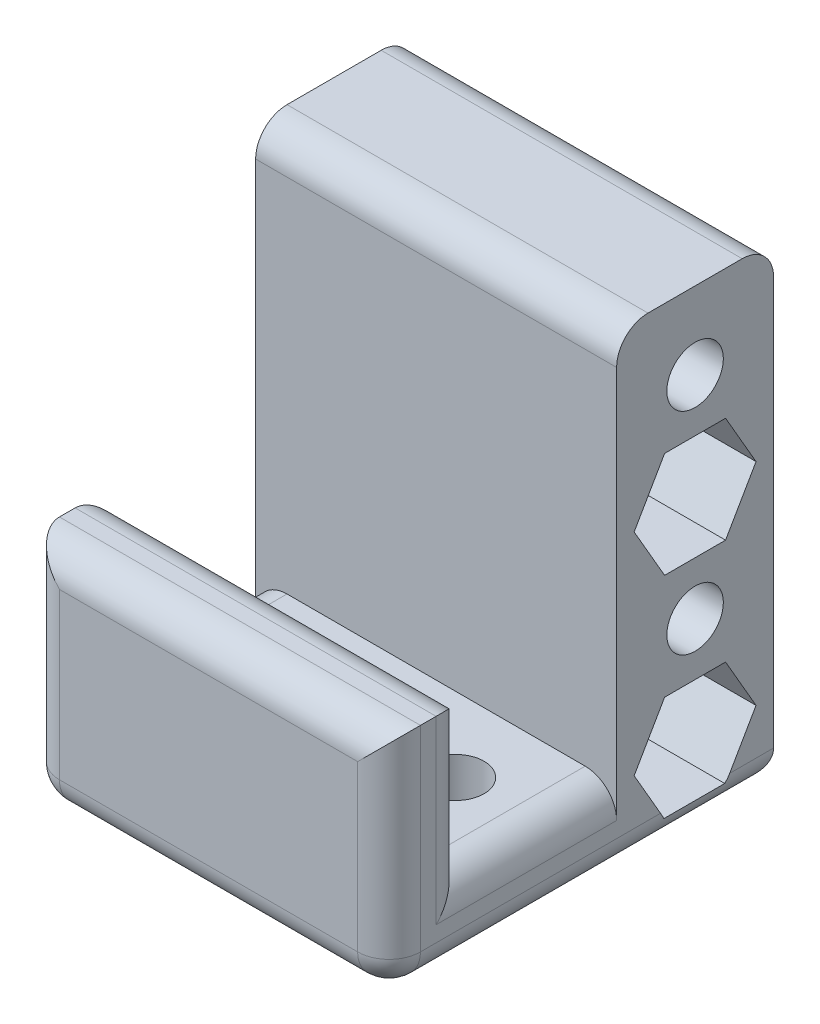
from build123d import *

# Parameters (mm, degrees)
SKETCH1_R               = 1.8
BOSS_EXTRUDE1_DEPTH     = 11.5
CUT_EXTRUDE1_START      = -5
SKETCH1_3_R             = 1.8
CUT_EXTRUDE1_DEPTH      = 18.523598736
CUT_EXTRUDE2_START      = 5
SKETCH1_4_R             = 1.8
CUT_EXTRUDE2_DEPTH      = 18.523598736
CUT_EXTRUDE3_DEPTH      = 23.523598736
CUT_EXTRUDE3_DEPTH_BACK = 23.523598736
SKETCH2_R               = 1.8
FILLET1_R               = 2


with BuildPart() as part:
    # Sketch1 → Boss-Extrude1 (new, symmetric)
    with BuildSketch(Plane(origin=(0, 0, 0), x_dir=(0, 0, -1), z_dir=(1, 0, 0))):
        Polygon((-12.25, -0.5), (-7.25, -0.5), (-7.25, -10), (2.25, -10), (2.25, 15), (12.25, 15), (12.25, -15), (-12.25, -15), align=None)
        with Locations((7.25, 10.0887)):
            Circle(SKETCH1_R, mode=Mode.SUBTRACT)
        with Locations((7.25, 3.3629)):
            Circle(SKETCH1_R, mode=Mode.SUBTRACT)
        with Locations((7.25, -3.3629)):
            Circle(SKETCH1_R, mode=Mode.SUBTRACT)
        with Locations((7.25, -10.0887)):
            Circle(SKETCH1_R, mode=Mode.SUBTRACT)
    extrude(amount=BOSS_EXTRUDE1_DEPTH, both=True)

    # Sketch1<3> → Cut-Extrude1 (cut, through all)
    # profile 1 of 2: a face of its own
    with BuildSketch(Plane(origin=(0, 0, 0), x_dir=(0, 0, -1), z_dir=(1, 0, 0)).offset(CUT_EXTRUDE1_START)):
        Polygon((9.19157122, 13.4516), (5.30842878, 13.4516), (3.366857559, 10.0887), (5.30842878, 6.7258), (9.19157122, 6.7258), (11.133142441, 10.0887), align=None)
        with Locations((7.25, 10.0887)):
            Circle(SKETCH1_3_R, mode=Mode.SUBTRACT)
    # profile 2 of 2: a face of its own
    with BuildSketch(Plane(origin=(0, 0, 0), x_dir=(0, 0, -1), z_dir=(1, 0, 0)).offset(CUT_EXTRUDE1_START)):
        Polygon((5.30842878, 0), (9.19157122, 0), (11.133142441, -3.3629), (9.19157122, -6.7258), (5.30842878, -6.7258), (3.366857559, -3.3629), align=None)
        with Locations((7.25, -3.3629)):
            Circle(SKETCH1_3_R, mode=Mode.SUBTRACT)
    extrude(amount=-CUT_EXTRUDE1_DEPTH, mode=Mode.SUBTRACT)

    # Sketch1<4> → Cut-Extrude2 (cut, through all)
    # profile 1 of 2: a face of its own
    with BuildSketch(Plane(origin=(0, 0, 0), x_dir=(0, 0, -1), z_dir=(1, 0, 0)).offset(CUT_EXTRUDE2_START)):
        Polygon((5.30842878, 6.7258), (9.19157122, 6.7258), (11.133142441, 3.3629), (9.19157122, 0), (5.30842878, 0), (3.366857559, 3.3629), align=None)
        with Locations((7.25, 3.3629)):
            Circle(SKETCH1_4_R, mode=Mode.SUBTRACT)
    # profile 2 of 2: a face of its own
    with BuildSketch(Plane(origin=(0, 0, 0), x_dir=(0, 0, -1), z_dir=(1, 0, 0)).offset(CUT_EXTRUDE2_START)):
        Polygon((5.30842878, -6.7258), (9.19157122, -6.7258), (11.133142441, -10.0887), (9.19157122, -13.4516), (5.30842878, -13.4516), (3.366857559, -10.0887), align=None)
        with Locations((7.25, -10.0887)):
            Circle(SKETCH1_4_R, mode=Mode.SUBTRACT)
    extrude(amount=CUT_EXTRUDE2_DEPTH, mode=Mode.SUBTRACT)

    # Sketch2 → Cut-Extrude3 (cut, two sides: drawn at the far end of the back side and taken through both)
    with BuildSketch(Plane(origin=(0, 0, 0), x_dir=(1, 0, 0), z_dir=(0, 1, 0)).offset(-CUT_EXTRUDE3_DEPTH_BACK)):
        with Locations(Location((-6, -2.5, 0), (0, 0, 270))):
            Circle(SKETCH2_R)
        with Locations(Location((6, -2.5, 0), (0, 0, 270))):
            Circle(SKETCH2_R)
    extrude(amount=CUT_EXTRUDE3_DEPTH + CUT_EXTRUDE3_DEPTH_BACK, mode=Mode.SUBTRACT)

    # Fillet1
    # the kernel refuses this fillet: 2 mm, written as the material it takes off along each edge
    with BuildSketch(Plane(origin=(-9.5, -13, 10.25), x_dir=(-1, 0, 0), z_dir=(0, 0, 1))) as fillet1_piece_1_section:
        Polygon((0, 0), (FILLET1_R * 1.02, 0), (FILLET1_R * 1.02, FILLET1_R * 1.02), (0, FILLET1_R * 1.02), align=None)
    fillet1_piece_1 = extrude(amount=FILLET1_R * 1.02, mode=Mode.PRIVATE)
    fillet1_piece_1 = fillet1_piece_1 - Plane(origin=(-9.5, -13, 10.25), x_dir=(0.7071067811865475, 0.7071067811865475, 0), z_dir=(0, 0, 1)) * Sphere(FILLET1_R, mode=Mode.PRIVATE)
    add(fillet1_piece_1, mode=Mode.SUBTRACT)
    with BuildSketch(Plane(origin=(9.5, -13, 10.25), x_dir=(1, 0, 0), z_dir=(0, 0, 1))) as fillet1_piece_2_section:
        Polygon((0, 0), (FILLET1_R * 1.02, 0), (FILLET1_R * 1.02, -FILLET1_R * 1.02), (0, -FILLET1_R * 1.02), align=None)
    fillet1_piece_2 = extrude(amount=FILLET1_R * 1.02, mode=Mode.PRIVATE)
    fillet1_piece_2 = fillet1_piece_2 - Plane(origin=(9.5, -13, 10.25), x_dir=(-0.7071067811865475, 0.7071067811865475, 0), z_dir=(0, 0, 1)) * Sphere(FILLET1_R, mode=Mode.PRIVATE)
    add(fillet1_piece_2, mode=Mode.SUBTRACT)
    with BuildSketch(Plane(origin=(-11.5, -10, 7.25), x_dir=(0, -1, 0), z_dir=(0, 0, -1)), Plane(origin=(-11.5, -0.5, 7.25), x_dir=(0, 0, 1), z_dir=(0, -1, 0)), Plane(origin=(11.5, -0.5, 7.25), x_dir=(-1, 0, 0), z_dir=(0, -1, 0))) as fillet1_piece_3:
        with BuildLine():
            CenterArc((FILLET1_R, -FILLET1_R), FILLET1_R, 90, 90)
            Line((0, -FILLET1_R), (-FILLET1_R * 0.02, -FILLET1_R))
            Line((-FILLET1_R * 0.02, -FILLET1_R), (-FILLET1_R * 0.02, FILLET1_R * 0.02))
            Line((-FILLET1_R * 0.02, FILLET1_R * 0.02), (FILLET1_R, FILLET1_R * 0.02))
            Line((FILLET1_R, FILLET1_R * 0.02), (FILLET1_R, 0))
        make_face()
    extrude(amount=9.5, mode=Mode.SUBTRACT)
    with BuildSketch(Plane(origin=(11.5, -10, 7.25), x_dir=(0, -1, 0), z_dir=(0, 0, -1))) as fillet1_piece_4:
        with BuildLine():
            CenterArc((FILLET1_R, FILLET1_R), FILLET1_R, 180, 90)
            Line((0, FILLET1_R), (-FILLET1_R * 0.02, FILLET1_R))
            Line((-FILLET1_R * 0.02, FILLET1_R), (-FILLET1_R * 0.02, -FILLET1_R * 0.02))
            Line((-FILLET1_R * 0.02, -FILLET1_R * 0.02), (FILLET1_R, -FILLET1_R * 0.02))
            Line((FILLET1_R, -FILLET1_R * 0.02), (FILLET1_R, 0))
        make_face()
    extrude(amount=9.5, mode=Mode.SUBTRACT)
    with BuildSketch(Plane(origin=(-11.5, -15, -12.25), x_dir=(0, 1, 0), z_dir=(0, 0, 1))) as fillet1_piece_5:
        with BuildLine():
            CenterArc((FILLET1_R, -FILLET1_R), FILLET1_R, 90, 90)
            Line((0, -FILLET1_R), (-FILLET1_R * 0.02, -FILLET1_R))
            Line((-FILLET1_R * 0.02, -FILLET1_R), (-FILLET1_R * 0.02, FILLET1_R * 0.02))
            Line((-FILLET1_R * 0.02, FILLET1_R * 0.02), (FILLET1_R, FILLET1_R * 0.02))
            Line((FILLET1_R, FILLET1_R * 0.02), (FILLET1_R, 0))
        make_face()
    extrude(amount=22.5, mode=Mode.SUBTRACT)
    with BuildSketch(Plane(origin=(11.5, -15, -12.25), x_dir=(0, 1, 0), z_dir=(0, 0, 1))) as fillet1_piece_6:
        with BuildLine():
            CenterArc((FILLET1_R, FILLET1_R), FILLET1_R, 180, 90)
            Line((0, FILLET1_R), (-FILLET1_R * 0.02, FILLET1_R))
            Line((-FILLET1_R * 0.02, FILLET1_R), (-FILLET1_R * 0.02, -FILLET1_R * 0.02))
            Line((-FILLET1_R * 0.02, -FILLET1_R * 0.02), (FILLET1_R, -FILLET1_R * 0.02))
            Line((FILLET1_R, -FILLET1_R * 0.02), (FILLET1_R, 0))
        make_face()
    extrude(amount=22.5, mode=Mode.SUBTRACT)
    with BuildSketch(Plane(origin=(-11.5, -13, 12.25), x_dir=(1, 0, 0), z_dir=(0, 1, 0))) as fillet1_piece_7:
        with BuildLine():
            CenterArc((FILLET1_R, FILLET1_R), FILLET1_R, 180, 90)
            Line((0, FILLET1_R), (-FILLET1_R * 0.02, FILLET1_R))
            Line((-FILLET1_R * 0.02, FILLET1_R), (-FILLET1_R * 0.02, -FILLET1_R * 0.02))
            Line((-FILLET1_R * 0.02, -FILLET1_R * 0.02), (FILLET1_R, -FILLET1_R * 0.02))
            Line((FILLET1_R, -FILLET1_R * 0.02), (FILLET1_R, 0))
        make_face()
    extrude(amount=12.5, mode=Mode.SUBTRACT)
    with BuildSketch(Plane(origin=(11.5, -13, 12.25), x_dir=(-1, 0, 0), z_dir=(0, 1, 0))) as fillet1_piece_8:
        with BuildLine():
            CenterArc((FILLET1_R, -FILLET1_R), FILLET1_R, 90, 90)
            Line((0, -FILLET1_R), (-FILLET1_R * 0.02, -FILLET1_R))
            Line((-FILLET1_R * 0.02, -FILLET1_R), (-FILLET1_R * 0.02, FILLET1_R * 0.02))
            Line((-FILLET1_R * 0.02, FILLET1_R * 0.02), (FILLET1_R, FILLET1_R * 0.02))
            Line((FILLET1_R, FILLET1_R * 0.02), (FILLET1_R, 0))
        make_face()
    extrude(amount=12.5, mode=Mode.SUBTRACT)
    with BuildSketch(Plane(origin=(11.5, 15, -2.25), x_dir=(0, -1, 0), z_dir=(-1, 0, 0)), Plane(origin=(-11.5, -15, -12.25), x_dir=(0, 0, 1), z_dir=(1, 0, 0)), Plane(origin=(11.5, -0.5, 7.25), x_dir=(0, 0, 1), z_dir=(-1, 0, 0)), Plane(origin=(-11.5, -0.5, 12.25), x_dir=(0, 0, -1), z_dir=(1, 0, 0))) as fillet1_piece_9:
        with BuildLine():
            CenterArc((FILLET1_R, -FILLET1_R), FILLET1_R, 90, 90)
            Line((0, -FILLET1_R), (-FILLET1_R * 0.02, -FILLET1_R))
            Line((-FILLET1_R * 0.02, -FILLET1_R), (-FILLET1_R * 0.02, FILLET1_R * 0.02))
            Line((-FILLET1_R * 0.02, FILLET1_R * 0.02), (FILLET1_R, FILLET1_R * 0.02))
            Line((FILLET1_R, FILLET1_R * 0.02), (FILLET1_R, 0))
        make_face()
    extrude(amount=23, mode=Mode.SUBTRACT)
    with BuildSketch(Plane(origin=(11.5, 15, -12.25), x_dir=(0, -1, 0), z_dir=(-1, 0, 0))) as fillet1_piece_10:
        with BuildLine():
            CenterArc((FILLET1_R, FILLET1_R), FILLET1_R, 180, 90)
            Line((0, FILLET1_R), (-FILLET1_R * 0.02, FILLET1_R))
            Line((-FILLET1_R * 0.02, FILLET1_R), (-FILLET1_R * 0.02, -FILLET1_R * 0.02))
            Line((-FILLET1_R * 0.02, -FILLET1_R * 0.02), (FILLET1_R, -FILLET1_R * 0.02))
            Line((FILLET1_R, -FILLET1_R * 0.02), (FILLET1_R, 0))
        make_face()
    extrude(amount=23, mode=Mode.SUBTRACT)
    with BuildSketch(Plane(origin=(-9.5, -15, 12.25), x_dir=(0, 1, 0), z_dir=(1, 0, 0))) as fillet1_piece_11:
        with BuildLine():
            CenterArc((FILLET1_R, -FILLET1_R), FILLET1_R, 90, 90)
            Line((0, -FILLET1_R), (-FILLET1_R * 0.02, -FILLET1_R))
            Line((-FILLET1_R * 0.02, -FILLET1_R), (-FILLET1_R * 0.02, FILLET1_R * 0.02))
            Line((-FILLET1_R * 0.02, FILLET1_R * 0.02), (FILLET1_R, FILLET1_R * 0.02))
            Line((FILLET1_R, FILLET1_R * 0.02), (FILLET1_R, 0))
        make_face()
    extrude(amount=19, mode=Mode.SUBTRACT)
    with BuildSketch(Plane(origin=(-11.5, -0.5, 7.25), x_dir=(0, 0, 1), z_dir=(0, -1, 0))) as fillet1_piece_12a_section:
        with BuildLine():
            CenterArc((FILLET1_R, -FILLET1_R), FILLET1_R, 90, 90)
            Line((0, -FILLET1_R), (-FILLET1_R * 0.02, -FILLET1_R))
            Line((-FILLET1_R * 0.02, -FILLET1_R), (-FILLET1_R * 0.02, FILLET1_R * 0.02))
            Line((-FILLET1_R * 0.02, FILLET1_R * 0.02), (FILLET1_R, FILLET1_R * 0.02))
            Line((FILLET1_R, FILLET1_R * 0.02), (FILLET1_R, 0))
        make_face()
    fillet1_piece_12a = extrude(amount=14.5, mode=Mode.PRIVATE)
    fillet1_piece_12a = split(fillet1_piece_12a, bisect_by=Plane(origin=(-11.047209771, -10, 7.702790229), z_dir=(0, -1, 0)), keep=Keep.TOP, mode=Mode.PRIVATE)
    with BuildSketch(Plane(origin=(-11.5, -10, 12.25), x_dir=(0, -1, 0), z_dir=(0, 0, -1))) as fillet1_piece_12b_section:
        with BuildLine():
            CenterArc((FILLET1_R, -FILLET1_R), FILLET1_R, 90, 90)
            Line((0, -FILLET1_R), (-FILLET1_R * 0.02, -FILLET1_R))
            Line((-FILLET1_R * 0.02, -FILLET1_R), (-FILLET1_R * 0.02, FILLET1_R * 0.02))
            Line((-FILLET1_R * 0.02, FILLET1_R * 0.02), (FILLET1_R, FILLET1_R * 0.02))
            Line((FILLET1_R, FILLET1_R * 0.02), (FILLET1_R, 0))
        make_face()
    fillet1_piece_12b = extrude(amount=14.5, mode=Mode.PRIVATE)
    fillet1_piece_12b = split(fillet1_piece_12b, bisect_by=Plane(origin=(-11.047209771, -10.452790229, 7.25), z_dir=(0, 0, 1)), keep=Keep.TOP, mode=Mode.PRIVATE)
    fillet1_piece_12 = fillet1_piece_12a & fillet1_piece_12b
    add(fillet1_piece_12, mode=Mode.SUBTRACT)
    with BuildSketch(Plane(origin=(11.5, -0.5, 7.25), x_dir=(-1, 0, 0), z_dir=(0, -1, 0))) as fillet1_piece_13a_section:
        with BuildLine():
            CenterArc((FILLET1_R, -FILLET1_R), FILLET1_R, 90, 90)
            Line((0, -FILLET1_R), (-FILLET1_R * 0.02, -FILLET1_R))
            Line((-FILLET1_R * 0.02, -FILLET1_R), (-FILLET1_R * 0.02, FILLET1_R * 0.02))
            Line((-FILLET1_R * 0.02, FILLET1_R * 0.02), (FILLET1_R, FILLET1_R * 0.02))
            Line((FILLET1_R, FILLET1_R * 0.02), (FILLET1_R, 0))
        make_face()
    fillet1_piece_13a = extrude(amount=14.5, mode=Mode.PRIVATE)
    fillet1_piece_13a = split(fillet1_piece_13a, bisect_by=Plane(origin=(11.047209771, -10, 7.702790229), z_dir=(0, -1, 0)), keep=Keep.TOP, mode=Mode.PRIVATE)
    with BuildSketch(Plane(origin=(11.5, -10, 12.25), x_dir=(0, -1, 0), z_dir=(0, 0, -1))) as fillet1_piece_13b_section:
        with BuildLine():
            CenterArc((FILLET1_R, FILLET1_R), FILLET1_R, 180, 90)
            Line((0, FILLET1_R), (-FILLET1_R * 0.02, FILLET1_R))
            Line((-FILLET1_R * 0.02, FILLET1_R), (-FILLET1_R * 0.02, -FILLET1_R * 0.02))
            Line((-FILLET1_R * 0.02, -FILLET1_R * 0.02), (FILLET1_R, -FILLET1_R * 0.02))
            Line((FILLET1_R, -FILLET1_R * 0.02), (FILLET1_R, 0))
        make_face()
    fillet1_piece_13b = extrude(amount=14.5, mode=Mode.PRIVATE)
    fillet1_piece_13b = split(fillet1_piece_13b, bisect_by=Plane(origin=(11.047209771, -10.452790229, 7.25), z_dir=(0, 0, 1)), keep=Keep.TOP, mode=Mode.PRIVATE)
    fillet1_piece_13 = fillet1_piece_13a & fillet1_piece_13b
    add(fillet1_piece_13, mode=Mode.SUBTRACT)
    with BuildSketch(Plane(origin=(11.5, -0.5, 7.25), x_dir=(0, 0, 1), z_dir=(-1, 0, 0))) as fillet1_piece_14a_section:
        with BuildLine():
            CenterArc((FILLET1_R, -FILLET1_R), FILLET1_R, 90, 90)
            Line((0, -FILLET1_R), (-FILLET1_R * 0.02, -FILLET1_R))
            Line((-FILLET1_R * 0.02, -FILLET1_R), (-FILLET1_R * 0.02, FILLET1_R * 0.02))
            Line((-FILLET1_R * 0.02, FILLET1_R * 0.02), (FILLET1_R, FILLET1_R * 0.02))
            Line((FILLET1_R, FILLET1_R * 0.02), (FILLET1_R, 0))
        make_face()
    fillet1_piece_14a = extrude(amount=28, mode=Mode.PRIVATE)
    fillet1_piece_14a = split(fillet1_piece_14a, bisect_by=Plane(origin=(-11.5, -0.952790229, 7.702790229), z_dir=(-1, 0, 0)), keep=Keep.TOP, mode=Mode.PRIVATE)
    with BuildSketch(Plane(origin=(-11.5, 4.5, 7.25), x_dir=(0, 0, 1), z_dir=(0, -1, 0))) as fillet1_piece_14b_section:
        with BuildLine():
            CenterArc((FILLET1_R, -FILLET1_R), FILLET1_R, 90, 90)
            Line((0, -FILLET1_R), (-FILLET1_R * 0.02, -FILLET1_R))
            Line((-FILLET1_R * 0.02, -FILLET1_R), (-FILLET1_R * 0.02, FILLET1_R * 0.02))
            Line((-FILLET1_R * 0.02, FILLET1_R * 0.02), (FILLET1_R, FILLET1_R * 0.02))
            Line((FILLET1_R, FILLET1_R * 0.02), (FILLET1_R, 0))
        make_face()
    fillet1_piece_14b = extrude(amount=14.5, mode=Mode.PRIVATE)
    fillet1_piece_14b = split(fillet1_piece_14b, bisect_by=Plane(origin=(-11.047209771, -0.5, 7.702790229), z_dir=(0, 1, 0)), keep=Keep.TOP, mode=Mode.PRIVATE)
    fillet1_piece_14 = fillet1_piece_14a & fillet1_piece_14b
    add(fillet1_piece_14, mode=Mode.SUBTRACT)
    with BuildSketch(Plane(origin=(16.5, -0.5, 7.25), x_dir=(0, 0, 1), z_dir=(-1, 0, 0))) as fillet1_piece_15a_section:
        with BuildLine():
            CenterArc((FILLET1_R, -FILLET1_R), FILLET1_R, 90, 90)
            Line((0, -FILLET1_R), (-FILLET1_R * 0.02, -FILLET1_R))
            Line((-FILLET1_R * 0.02, -FILLET1_R), (-FILLET1_R * 0.02, FILLET1_R * 0.02))
            Line((-FILLET1_R * 0.02, FILLET1_R * 0.02), (FILLET1_R, FILLET1_R * 0.02))
            Line((FILLET1_R, FILLET1_R * 0.02), (FILLET1_R, 0))
        make_face()
    fillet1_piece_15a = extrude(amount=28, mode=Mode.PRIVATE)
    fillet1_piece_15a = split(fillet1_piece_15a, bisect_by=Plane(origin=(11.5, -0.952790229, 7.702790229), z_dir=(1, 0, 0)), keep=Keep.TOP, mode=Mode.PRIVATE)
    with BuildSketch(Plane(origin=(11.5, 4.5, 7.25), x_dir=(-1, 0, 0), z_dir=(0, -1, 0))) as fillet1_piece_15b_section:
        with BuildLine():
            CenterArc((FILLET1_R, -FILLET1_R), FILLET1_R, 90, 90)
            Line((0, -FILLET1_R), (-FILLET1_R * 0.02, -FILLET1_R))
            Line((-FILLET1_R * 0.02, -FILLET1_R), (-FILLET1_R * 0.02, FILLET1_R * 0.02))
            Line((-FILLET1_R * 0.02, FILLET1_R * 0.02), (FILLET1_R, FILLET1_R * 0.02))
            Line((FILLET1_R, FILLET1_R * 0.02), (FILLET1_R, 0))
        make_face()
    fillet1_piece_15b = extrude(amount=14.5, mode=Mode.PRIVATE)
    fillet1_piece_15b = split(fillet1_piece_15b, bisect_by=Plane(origin=(11.047209771, -0.5, 7.702790229), z_dir=(0, 1, 0)), keep=Keep.TOP, mode=Mode.PRIVATE)
    fillet1_piece_15 = fillet1_piece_15a & fillet1_piece_15b
    add(fillet1_piece_15, mode=Mode.SUBTRACT)
    with BuildSketch(Plane(origin=(-11.5, -15, -17.25), x_dir=(0, 1, 0), z_dir=(0, 0, 1))) as fillet1_piece_16a_section:
        with BuildLine():
            CenterArc((FILLET1_R, -FILLET1_R), FILLET1_R, 90, 90)
            Line((0, -FILLET1_R), (-FILLET1_R * 0.02, -FILLET1_R))
            Line((-FILLET1_R * 0.02, -FILLET1_R), (-FILLET1_R * 0.02, FILLET1_R * 0.02))
            Line((-FILLET1_R * 0.02, FILLET1_R * 0.02), (FILLET1_R, FILLET1_R * 0.02))
            Line((FILLET1_R, FILLET1_R * 0.02), (FILLET1_R, 0))
        make_face()
    fillet1_piece_16a = extrude(amount=27.5, mode=Mode.PRIVATE)
    fillet1_piece_16a = split(fillet1_piece_16a, bisect_by=Plane(origin=(-11.047209771, -14.547209771, -12.25), z_dir=(0, 0, -1)), keep=Keep.TOP, mode=Mode.PRIVATE)
    with BuildSketch(Plane(origin=(-16.5, -15, -12.25), x_dir=(0, 0, 1), z_dir=(1, 0, 0))) as fillet1_piece_16b_section:
        with BuildLine():
            CenterArc((FILLET1_R, -FILLET1_R), FILLET1_R, 90, 90)
            Line((0, -FILLET1_R), (-FILLET1_R * 0.02, -FILLET1_R))
            Line((-FILLET1_R * 0.02, -FILLET1_R), (-FILLET1_R * 0.02, FILLET1_R * 0.02))
            Line((-FILLET1_R * 0.02, FILLET1_R * 0.02), (FILLET1_R, FILLET1_R * 0.02))
            Line((FILLET1_R, FILLET1_R * 0.02), (FILLET1_R, 0))
        make_face()
    fillet1_piece_16b = extrude(amount=28, mode=Mode.PRIVATE)
    fillet1_piece_16b = split(fillet1_piece_16b, bisect_by=Plane(origin=(-11.5, -14.547209771, -11.797209771), z_dir=(-1, 0, 0)), keep=Keep.TOP, mode=Mode.PRIVATE)
    fillet1_piece_16 = fillet1_piece_16a & fillet1_piece_16b
    add(fillet1_piece_16, mode=Mode.SUBTRACT)
    with BuildSketch(Plane(origin=(11.5, -15, -17.25), x_dir=(0, 1, 0), z_dir=(0, 0, 1))) as fillet1_piece_17a_section:
        with BuildLine():
            CenterArc((FILLET1_R, FILLET1_R), FILLET1_R, 180, 90)
            Line((0, FILLET1_R), (-FILLET1_R * 0.02, FILLET1_R))
            Line((-FILLET1_R * 0.02, FILLET1_R), (-FILLET1_R * 0.02, -FILLET1_R * 0.02))
            Line((-FILLET1_R * 0.02, -FILLET1_R * 0.02), (FILLET1_R, -FILLET1_R * 0.02))
            Line((FILLET1_R, -FILLET1_R * 0.02), (FILLET1_R, 0))
        make_face()
    fillet1_piece_17a = extrude(amount=27.5, mode=Mode.PRIVATE)
    fillet1_piece_17a = split(fillet1_piece_17a, bisect_by=Plane(origin=(11.047209771, -14.547209771, -12.25), z_dir=(0, 0, -1)), keep=Keep.TOP, mode=Mode.PRIVATE)
    with BuildSketch(Plane(origin=(-11.5, -15, -12.25), x_dir=(0, 0, 1), z_dir=(1, 0, 0))) as fillet1_piece_17b_section:
        with BuildLine():
            CenterArc((FILLET1_R, -FILLET1_R), FILLET1_R, 90, 90)
            Line((0, -FILLET1_R), (-FILLET1_R * 0.02, -FILLET1_R))
            Line((-FILLET1_R * 0.02, -FILLET1_R), (-FILLET1_R * 0.02, FILLET1_R * 0.02))
            Line((-FILLET1_R * 0.02, FILLET1_R * 0.02), (FILLET1_R, FILLET1_R * 0.02))
            Line((FILLET1_R, FILLET1_R * 0.02), (FILLET1_R, 0))
        make_face()
    fillet1_piece_17b = extrude(amount=28, mode=Mode.PRIVATE)
    fillet1_piece_17b = split(fillet1_piece_17b, bisect_by=Plane(origin=(11.5, -14.547209771, -11.797209771), z_dir=(1, 0, 0)), keep=Keep.TOP, mode=Mode.PRIVATE)
    fillet1_piece_17 = fillet1_piece_17a & fillet1_piece_17b
    add(fillet1_piece_17, mode=Mode.SUBTRACT)
    with BuildSketch(Plane(origin=(-16.5, -0.5, 12.25), x_dir=(0, 0, -1), z_dir=(1, 0, 0))) as fillet1_piece_18a_section:
        with BuildLine():
            CenterArc((FILLET1_R, -FILLET1_R), FILLET1_R, 90, 90)
            Line((0, -FILLET1_R), (-FILLET1_R * 0.02, -FILLET1_R))
            Line((-FILLET1_R * 0.02, -FILLET1_R), (-FILLET1_R * 0.02, FILLET1_R * 0.02))
            Line((-FILLET1_R * 0.02, FILLET1_R * 0.02), (FILLET1_R, FILLET1_R * 0.02))
            Line((FILLET1_R, FILLET1_R * 0.02), (FILLET1_R, 0))
        make_face()
    fillet1_piece_18a = extrude(amount=28, mode=Mode.PRIVATE)
    fillet1_piece_18a = split(fillet1_piece_18a, bisect_by=Plane(origin=(-11.5, -0.952790229, 11.797209771), z_dir=(-1, 0, 0)), keep=Keep.TOP, mode=Mode.PRIVATE)
    with BuildSketch(Plane(origin=(-11.5, -13, 12.25), x_dir=(1, 0, 0), z_dir=(0, 1, 0))) as fillet1_piece_18b_section:
        with BuildLine():
            CenterArc((FILLET1_R, FILLET1_R), FILLET1_R, 180, 90)
            Line((0, FILLET1_R), (-FILLET1_R * 0.02, FILLET1_R))
            Line((-FILLET1_R * 0.02, FILLET1_R), (-FILLET1_R * 0.02, -FILLET1_R * 0.02))
            Line((-FILLET1_R * 0.02, -FILLET1_R * 0.02), (FILLET1_R, -FILLET1_R * 0.02))
            Line((FILLET1_R, -FILLET1_R * 0.02), (FILLET1_R, 0))
        make_face()
    fillet1_piece_18b = extrude(amount=17.5, mode=Mode.PRIVATE)
    fillet1_piece_18b = split(fillet1_piece_18b, bisect_by=Plane(origin=(-11.047209771, -0.5, 11.797209771), z_dir=(0, 1, 0)), keep=Keep.TOP, mode=Mode.PRIVATE)
    fillet1_piece_18 = fillet1_piece_18a & fillet1_piece_18b
    add(fillet1_piece_18, mode=Mode.SUBTRACT)
    with BuildSketch(Plane(origin=(-11.5, -0.5, 12.25), x_dir=(0, 0, -1), z_dir=(1, 0, 0))) as fillet1_piece_19a_section:
        with BuildLine():
            CenterArc((FILLET1_R, -FILLET1_R), FILLET1_R, 90, 90)
            Line((0, -FILLET1_R), (-FILLET1_R * 0.02, -FILLET1_R))
            Line((-FILLET1_R * 0.02, -FILLET1_R), (-FILLET1_R * 0.02, FILLET1_R * 0.02))
            Line((-FILLET1_R * 0.02, FILLET1_R * 0.02), (FILLET1_R, FILLET1_R * 0.02))
            Line((FILLET1_R, FILLET1_R * 0.02), (FILLET1_R, 0))
        make_face()
    fillet1_piece_19a = extrude(amount=28, mode=Mode.PRIVATE)
    fillet1_piece_19a = split(fillet1_piece_19a, bisect_by=Plane(origin=(11.5, -0.952790229, 11.797209771), z_dir=(1, 0, 0)), keep=Keep.TOP, mode=Mode.PRIVATE)
    with BuildSketch(Plane(origin=(11.5, -13, 12.25), x_dir=(-1, 0, 0), z_dir=(0, 1, 0))) as fillet1_piece_19b_section:
        with BuildLine():
            CenterArc((FILLET1_R, -FILLET1_R), FILLET1_R, 90, 90)
            Line((0, -FILLET1_R), (-FILLET1_R * 0.02, -FILLET1_R))
            Line((-FILLET1_R * 0.02, -FILLET1_R), (-FILLET1_R * 0.02, FILLET1_R * 0.02))
            Line((-FILLET1_R * 0.02, FILLET1_R * 0.02), (FILLET1_R, FILLET1_R * 0.02))
            Line((FILLET1_R, FILLET1_R * 0.02), (FILLET1_R, 0))
        make_face()
    fillet1_piece_19b = extrude(amount=17.5, mode=Mode.PRIVATE)
    fillet1_piece_19b = split(fillet1_piece_19b, bisect_by=Plane(origin=(11.047209771, -0.5, 11.797209771), z_dir=(0, 1, 0)), keep=Keep.TOP, mode=Mode.PRIVATE)
    fillet1_piece_19 = fillet1_piece_19a & fillet1_piece_19b
    add(fillet1_piece_19, mode=Mode.SUBTRACT)


solid = part.part
